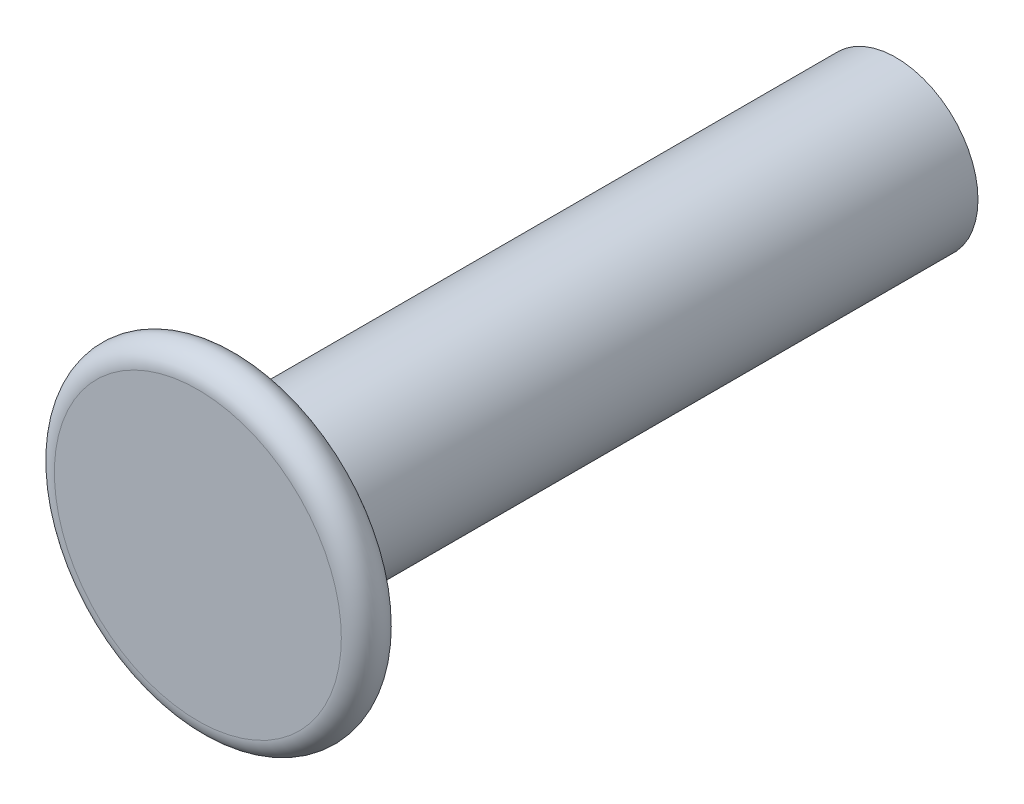
from build123d import *


with BuildPart() as part:
    # BaseBodySke → BaseBody (revolve)
    with BuildSketch(Plane(origin=(0, 0, 0), x_dir=(1, 0, 0), z_dir=(0, 1, 0))):
        with BuildLine():
            Line((0, 0), (-5.5499, 0))
            ThreePointArc((-5.5499, 0), (-6.35, 0.8001), (-5.5499, 1.6002))
            Line((-5.5499, 1.6002), (-3.175, 1.6002))
            Line((-3.175, 1.6002), (-3.175, 27.0002))
            Line((-3.175, 27.0002), (0, 27.0002))
            Line((0, 27.0002), (0, 0))
        make_face()
    revolve(axis=Axis((0, 0, 0), (0, 0, -1)))


solid = part.part
